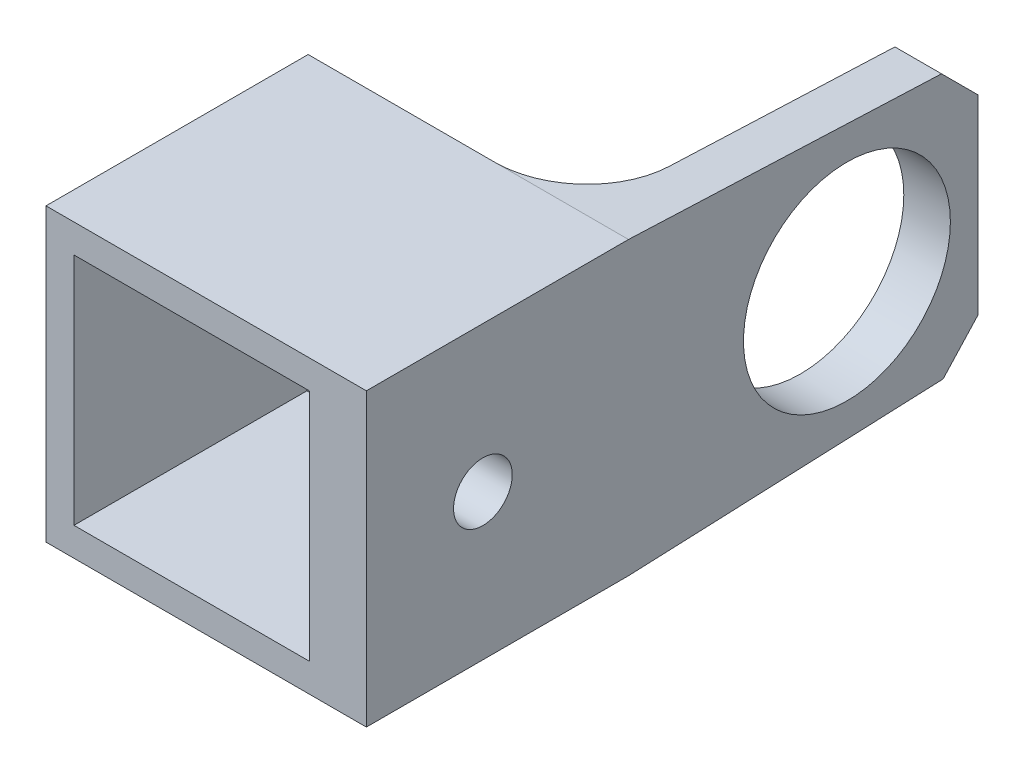
from build123d import *
from OCP.BRepFilletAPI import BRepFilletAPI_MakeChamfer

# Parameters (mm, degrees)
SKETCH1_W           = 31.75
SKETCH1_H           = 31.75
BOSS_EXTRUDE1_DEPTH = 28.575
SKETCH2_W           = 25.654
SKETCH2_H           = 25.527
CUT_EXTRUDE1_DEPTH  = 25.4
BOSS_EXTRUDE2_DEPTH = 3.175
BOSS_EXTRUDE3_DEPTH = 1.905
FILLET1_R           = 9.525
CUT_EXTRUDE2_REACH  = 56.068
SKETCH6_R           = 11.2776
SKETCH6_R_2         = 3.2004
CHAMFER1_SIZE       = 3.81
CHAMFER1_SIZE2      = 3.979101764


with BuildPart() as part:
    # Sketch1 → Boss-Extrude1 (new body)
    with BuildSketch(Plane.XY):
        Rectangle(SKETCH1_W, SKETCH1_H)
    extrude(amount=BOSS_EXTRUDE1_DEPTH)

    # Sketch2 → Cut-Extrude1 (cut)
    with BuildSketch(Plane.XY.offset(28.575)):
        Rectangle(SKETCH2_W, SKETCH2_H)
    extrude(amount=-CUT_EXTRUDE1_DEPTH, mode=Mode.SUBTRACT)

    # Sketch4 → Boss-Extrude2 (add)
    with BuildSketch(Plane(origin=(15.875, 0, 0), x_dir=(0, 0, -1), z_dir=(1, 0, 0))):
        Polygon((-28.575, -15.875), (0, -15.875), (38.1, -14.2875), (38.1, 14.2875), (0, 15.875), (-28.575, 15.875), align=None)
    extrude(amount=BOSS_EXTRUDE2_DEPTH)

    # Sketch5 → Boss-Extrude3 (add)
    with BuildSketch(Plane.ZY.offset(-15.875)):
        Polygon((-38.1, -14.2875), (0, -15.875), (0, 15.875), (-38.1, 14.2875), align=None)
    extrude(amount=BOSS_EXTRUDE3_DEPTH)

    # Fillet1
    # the kernel refuses this fillet: 9.525 mm, written as the material it adds along each edge
    with BuildSketch(Plane(origin=(13.97, -15.875, 0), x_dir=(-1, 0, 0), z_dir=(0, 1, 0))) as fillet1_piece_1_section:
        with BuildLine():
            CenterArc((FILLET1_R, -FILLET1_R), FILLET1_R, 90, 90)
            Line((0, -FILLET1_R), (0, 0))
            Line((0, 0), (FILLET1_R, 0))
        make_face()
    fillet1_piece_1 = extrude(amount=31.75, mode=Mode.PRIVATE)
    fillet1_piece_1 = split(fillet1_piece_1, bisect_by=Plane(origin=(11.807061563, -15.758253216, -2.801922808), z_dir=(0, 0.999133073092352, 0.04163054471218078)), keep=Keep.TOP, mode=Mode.PRIVATE)
    fillet1_piece_1 = split(fillet1_piece_1, bisect_by=Plane(origin=(11.807061563, 15.758253216, -2.801922808), z_dir=(0, -0.9991330730923519, 0.041630544712181895)), keep=Keep.TOP, mode=Mode.PRIVATE)
    add(fillet1_piece_1)

    # Sketch6 → Cut-Extrude2 (cut, up to next)
    with BuildSketch(Plane(origin=(19.05, 0, 0), x_dir=(0, 0, -1), z_dir=(1, 0, 0)), mode=Mode.PRIVATE) as cut_extrude2_sk1:
        with Locations((23.8125, 0)):
            Circle(SKETCH6_R)
    cut_extrude2_tool1 = extrude(cut_extrude2_sk1.sketch, amount=-CUT_EXTRUDE2_REACH, mode=Mode.PRIVATE) & part.part
    # Sketch6 → Cut-Extrude2 (cut, up to next)
    with BuildSketch(Plane(origin=(19.05, 0, 0), x_dir=(0, 0, -1), z_dir=(1, 0, 0)), mode=Mode.PRIVATE) as cut_extrude2_sk2:
        with Locations((-15.875, 0)):
            Circle(SKETCH6_R_2)
    cut_extrude2_tool2 = extrude(cut_extrude2_sk2.sketch, amount=-CUT_EXTRUDE2_REACH, mode=Mode.PRIVATE) & part.part
    add(cut_extrude2_tool1.solids().sort_by_distance((19.05, 0, -23.8125))[0], mode=Mode.SUBTRACT)
    add(cut_extrude2_tool2.solids().sort_by_distance((19.05, 0, 15.875))[0], mode=Mode.SUBTRACT)

    # Chamfer1: one chamfer whose edges measure the first distance from different faces: ONE call of the kernel's chamfer builder (chamfer() names one face for all edges)
    chamfer1_edges_1 = [part.edges().sort_by_distance(p)[0] for p in [
        (16.51, -14.2875, -38.1),
    ]]
    chamfer1_side_1 = [part.faces().sort_by_distance(p)[0] for p in [
        (16.083382106, -15.145696386, -17.503286726),
    ]]
    chamfer1_edges_2 = [part.edges().sort_by_distance(p)[0] for p in [
        (16.51, 14.2875, -38.1),
    ]]
    chamfer1_side_2 = [part.faces().sort_by_distance(p)[0] for p in [
        (16.51, 0, -38.1),
    ]]
    chamfer1 = BRepFilletAPI_MakeChamfer(part.part.solid().wrapped)
    for e in chamfer1_edges_1:
        chamfer1.Add(CHAMFER1_SIZE, CHAMFER1_SIZE2, e.wrapped, chamfer1_side_1[0].wrapped)  # the first distance lies on this face
    for e in chamfer1_edges_2:
        chamfer1.Add(CHAMFER1_SIZE, CHAMFER1_SIZE2, e.wrapped, chamfer1_side_2[0].wrapped)  # the first distance lies on this face
    add(Compound.cast(chamfer1.Shape()), mode=Mode.REPLACE)


solid = part.part
